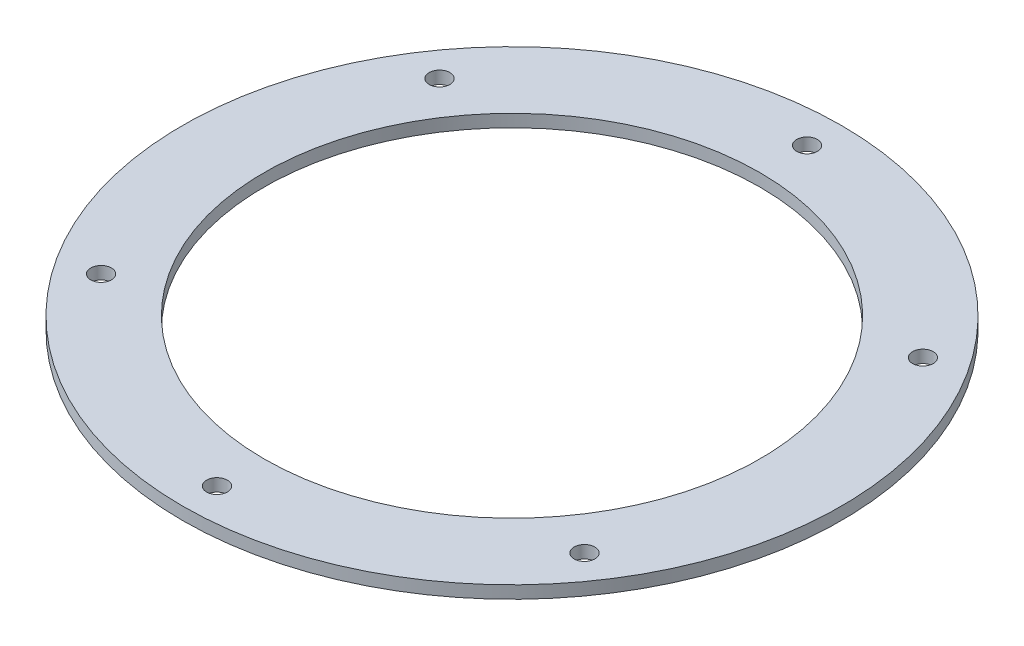
from build123d import *

# Parameters (mm, degrees)
SKETCH1_R           = 52.5
SKETCH1_R_2         = 39.5
BOSS_EXTRUDE1_DEPTH = 2
SKETCH2_R           = 1.65
CUT_EXTRUDE1_DEPTH  = 2


with BuildPart() as part:
    # Sketch1 → Boss-Extrude1 (new body)
    with BuildSketch(Plane(origin=(0, 0, 0), x_dir=(1, 0, 0), z_dir=(0, 1, 0))):
        Circle(SKETCH1_R)
        Circle(SKETCH1_R_2, mode=Mode.SUBTRACT)
    extrude(amount=BOSS_EXTRUDE1_DEPTH)

    # Sketch2 → Cut-Extrude1 (cut)
    with BuildSketch(Plane(origin=(0, 2, 0), x_dir=(1, 0, 0), z_dir=(0, 1, 0))):
        with Locations((0, 47)):
            Circle(SKETCH2_R)
        with Locations((0, -47)):
            Circle(SKETCH2_R)
        with Locations((-38.500146082, 26.958092508)):
            Circle(SKETCH2_R)
        with Locations((38.500146082, 26.958092508)):
            Circle(SKETCH2_R)
        with Locations((38.500146082, -26.958092508)):
            Circle(SKETCH2_R)
        with Locations((-38.500146082, -26.958092508)):
            Circle(SKETCH2_R)
    extrude(amount=-CUT_EXTRUDE1_DEPTH, mode=Mode.SUBTRACT)


solid = part.part
